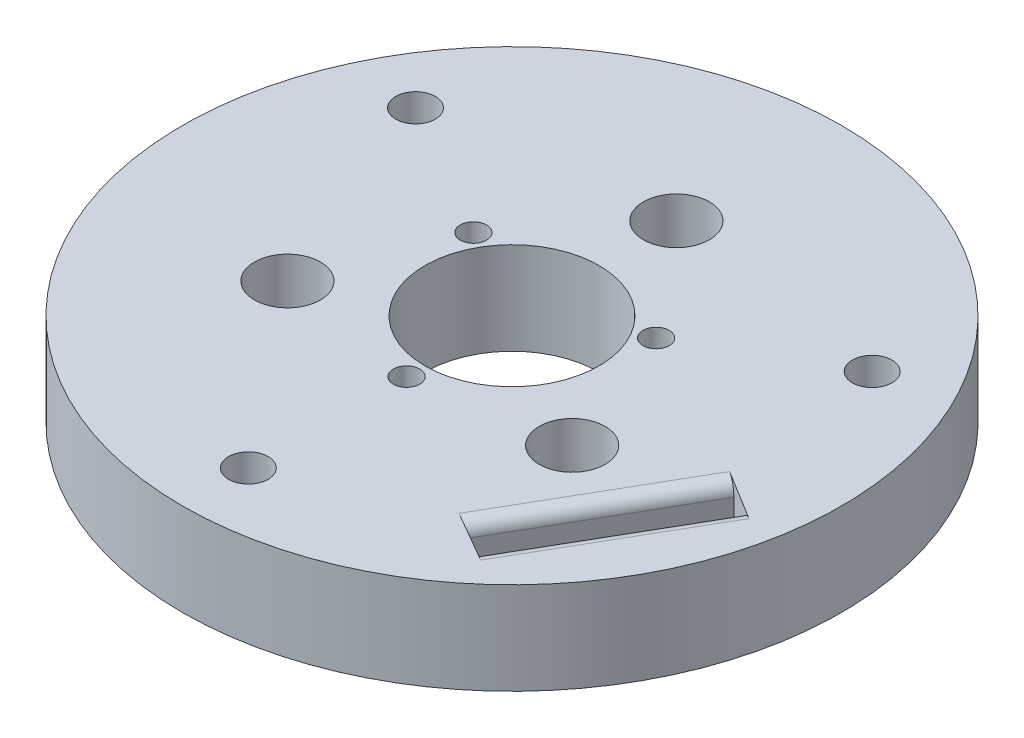
from build123d import *

# Parameters (mm, degrees)
SKETCH_1_R          = 25
SKETCH_1_R_2        = 6.6
SKETCH_1_R_3        = 1.3
EXTRUDE_1_DEPTH     = 7
SKETCH_2_R          = 2.5
CUT_EXTRUDE_2_DEPTH = 5
SKETCH_4_R          = 1
CUT_EXTRUDE_3_DEPTH = 6
SKETCH_5_R          = 1.5
CUT_EXTRUDE_4_DEPTH = 46.585724637
CUT_EXTRUDE_5_DEPTH = 2.7
CUT_EXTRUDE_6_DEPTH = 10
FILLET_1_R          = 1


with BuildPart() as part:
    # 草图1 → 凸台-拉伸1 (new body)
    with BuildSketch(Plane(origin=(0, 0, 0), x_dir=(1, 0, 0), z_dir=(0, 1, 0))):
        with Locations((0, -12.470765814)):
            Circle(SKETCH_1_R)
        with Locations((0, -12.470765814)):
            Circle(SKETCH_1_R_2, mode=Mode.SUBTRACT)
        with Locations((-10.8, -18.706148722)):
            Circle(SKETCH_1_R_3, mode=Mode.SUBTRACT)
        with Locations((10.8, -18.706148722)):
            Circle(SKETCH_1_R_3, mode=Mode.SUBTRACT)
        Circle(SKETCH_1_R_3, mode=Mode.SUBTRACT)
    extrude(amount=EXTRUDE_1_DEPTH)

    # 草图2 → 切除-拉伸2 (cut)
    with BuildSketch(Plane(origin=(0, 7, 0), x_dir=(1, 0, 0), z_dir=(0, 1, 0))):
        with Locations((-10.8, -18.706148722)):
            Circle(SKETCH_2_R)
        with Locations((10.8, -18.706148722)):
            Circle(SKETCH_2_R)
        Circle(SKETCH_2_R)
    extrude(amount=-CUT_EXTRUDE_2_DEPTH, mode=Mode.SUBTRACT)

    # 草图4 → 切除-拉伸3 (cut)
    with BuildSketch(Plane(origin=(0, 7, 0), x_dir=(1, 0, 0), z_dir=(0, 1, 0))):
        with Locations((-6.92820323, -8.470765814)):
            Circle(SKETCH_4_R)
        with Locations((6.92820323, -8.470765814)):
            Circle(SKETCH_4_R)
        with Locations((0, -20.470765814)):
            Circle(SKETCH_4_R)
    extrude(amount=-CUT_EXTRUDE_3_DEPTH, mode=Mode.SUBTRACT)

    # 草图5 → 切除-拉伸4 (cut, through all)
    with BuildSketch(Plane(origin=(0, 7, 0), x_dir=(1, 0, 0), z_dir=(0, 1, 0))):
        with Locations((-17.320508076, -2.470765814)):
            Circle(SKETCH_5_R)
        with Locations((0, -32.470765814)):
            Circle(SKETCH_5_R)
        with Locations((17.320508076, -2.470765814)):
            Circle(SKETCH_5_R)
    extrude(amount=-CUT_EXTRUDE_4_DEPTH, mode=Mode.SUBTRACT)

    # 草图6 → 切除-拉伸5 (cut)
    with BuildSketch(Plane.XZ):
        Polygon((3.290896534, 32.470765814), (1.645448267, 35.320765814), (-1.645448267, 35.320765814), (-3.290896534, 32.470765814), (-1.645448267, 29.620765814), (1.645448267, 29.620765814), align=None)
        Polygon((20.61140461, 2.470765814), (18.965956343, 5.320765814), (15.675059808, 5.320765814), (14.029611541, 2.470765814), (15.675059808, -0.379234186), (18.965956343, -0.379234186), align=None)
        Polygon((-14.029611541, 2.470765814), (-15.675059808, 5.320765814), (-18.965956343, 5.320765814), (-20.61140461, 2.470765814), (-18.965956343, -0.379234186), (-15.675059808, -0.379234186), align=None)
    extrude(amount=-CUT_EXTRUDE_5_DEPTH, mode=Mode.SUBTRACT)

    # 草图7 → 切除-拉伸6 (cut)
    with BuildSketch(Plane(origin=(0, 7, 0), x_dir=(1, 0, 0), z_dir=(0, 1, 0))):
        Polygon((19.338457268, -14.975575286), (11.838457268, -27.965956343), (14.003520778, -29.215956343), (21.468764488, -16.285774946), align=None)
    extrude(amount=-CUT_EXTRUDE_6_DEPTH, mode=Mode.SUBTRACT)

    # 圆角1
    fillet_1_edges = [part.edges().sort_by_distance(p)[0] for p in [
        (17.736142633, 7, 22.750865644),
        (15.588457268, 7, 21.470765814),
        (17.736142633, 0, 22.750865644),
        (15.588457268, 0, 21.470765814),
    ]]
    fillet(fillet_1_edges, radius=FILLET_1_R)


solid = part.part
